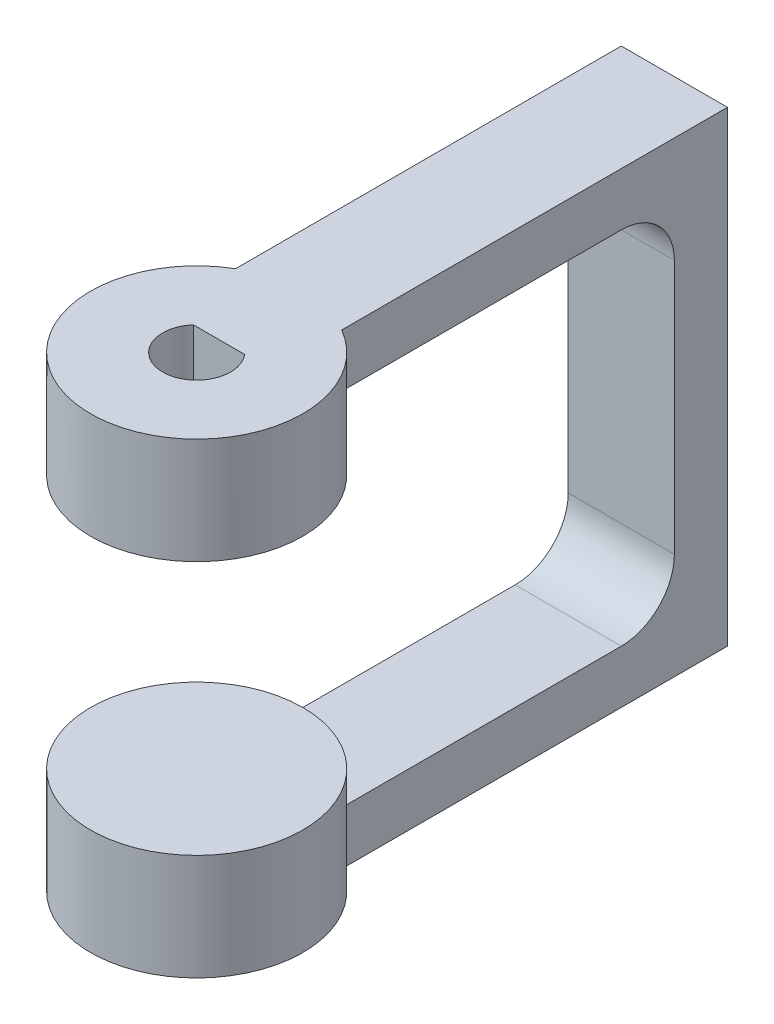
from build123d import *

# Parameters (mm, degrees)
SKETCH1_R               = 12.7
BOSS_EXTRUDE1_DEPTH     = 27.9146
CUT_EXTRUDE2_DEPTH      = 34.193446539
CUT_EXTRUDE2_DEPTH_BACK = 34.193446539
SKETCH4_W               = 25.4
SKETCH4_H               = 30.4292
BOSS_EXTRUDE2_DEPTH     = 6.35
CUT_EXTRUDE3_DEPTH      = 10.16
FILLET1_R               = 6.35


with BuildPart() as part:
    # Sketch1 → Boss-Extrude1 (new, symmetric)
    with BuildSketch(Plane(origin=(0, 0, 0), x_dir=(1, 0, 0), z_dir=(0, 1, 0))):
        Circle(SKETCH1_R)
    extrude(amount=BOSS_EXTRUDE1_DEPTH, both=True)

    # Sketch4 → Cut-Extrude2 (cut, two sides: drawn at the far end of the back side and taken through both)
    with BuildSketch(Plane.XY.offset(-CUT_EXTRUDE2_DEPTH_BACK)):
        Rectangle(SKETCH4_W, SKETCH4_H)
    extrude(amount=CUT_EXTRUDE2_DEPTH + CUT_EXTRUDE2_DEPTH_BACK, mode=Mode.SUBTRACT)


with BuildPart() as cut_extrude2_piece_1:
    # of the separate pieces the step leaves, piece 1, a body of its own (cut_extrude2_pieces)
    add(part.part.solids().sort_by_distance((12.7, -27.9146, 0))[0])



with BuildPart() as cut_extrude2_piece_2:
    # of the separate pieces the step leaves, piece 2, a body of its own (cut_extrude2_pieces)
    add(part.part.solids().sort_by_distance((12.7, 15.2146, 0))[0])


with BuildPart() as cut_extrude2_piece_1_1:
    add(cut_extrude2_piece_1.part)

    add(cut_extrude2_piece_2.part)  # Boss-Extrude2 merges Cut-Extrude2 piece 2
    # Sketch5 → Boss-Extrude2 (add, symmetric)
    with BuildSketch(Plane(origin=(0, 0, 0), x_dir=(0, 0, -1), z_dir=(1, 0, 0))):
        Polygon((0, 27.9146), (57.15, 27.9146), (57.15, -27.9146), (0, -27.9146), (0, -21.5646), (50.8, -21.5646), (50.8, 21.5646), (0, 21.5646), align=None)
    extrude(amount=BOSS_EXTRUDE2_DEPTH, both=True)

    # Sketch2 → Cut-Extrude3 (cut)
    with BuildSketch(Plane(origin=(0, 27.9146, 0), x_dir=(1, 0, 0), z_dir=(0, 1, 0))):
        with BuildLine():
            Line((-3.066464903, 2.667), (3.066464903, 2.667))
            ThreePointArc((3.066464903, 2.667), (0, -4.064), (-3.066464903, 2.667))
        make_face()
    cut_extrude3 = extrude(amount=-CUT_EXTRUDE3_DEPTH, mode=Mode.SUBTRACT)

    # Mirror1: Cut-Extrude3 across plane
    add(cut_extrude3.mirror(Plane.ZX), mode=Mode.SUBTRACT)

    # Fillet1
    fillet1_edges = [cut_extrude2_piece_1_1.edges().sort_by_distance(p)[0] for p in [
        (0, -21.5646, -50.8),
        (0, 21.5646, -50.8),
    ]]
    fillet(fillet1_edges, radius=FILLET1_R)


solid = cut_extrude2_piece_1_1.part
